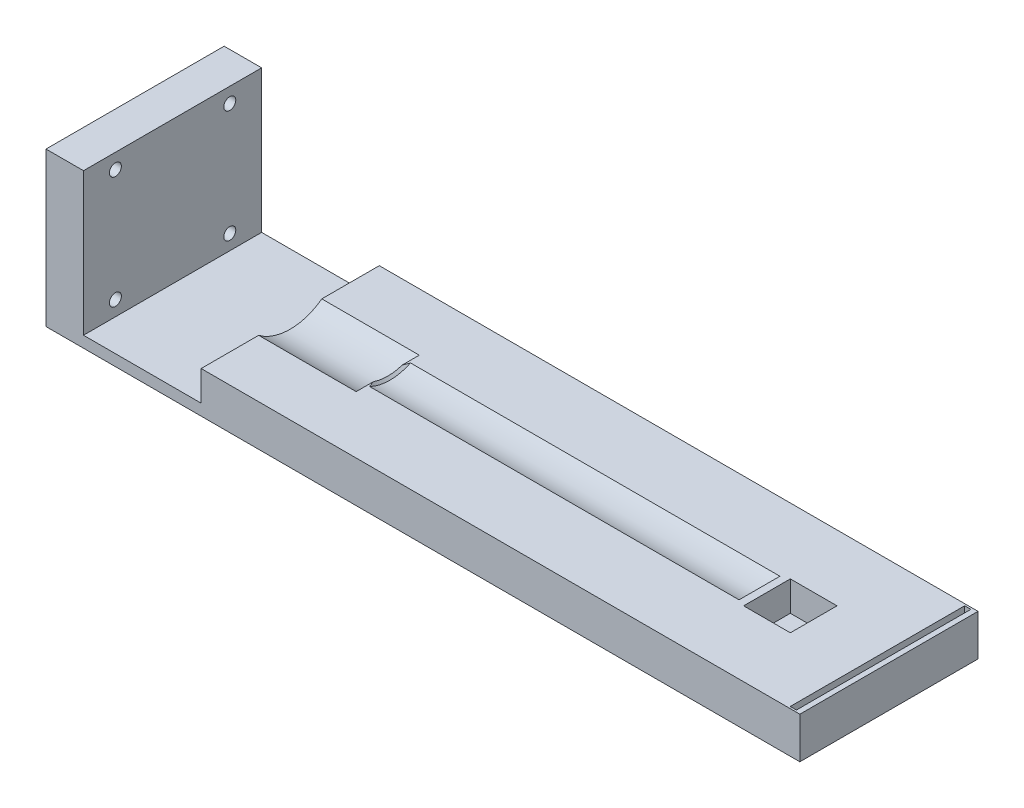
from build123d import *

# Parameters (mm, degrees)
SKETCH1_W               = 226
SKETCH1_H               = 84
BOSS_EXTRUDE1_DEPTH     = 20
SKETCH9_W               = 215
SKETCH9_H               = 38.50000016
BOSS_EXTRUDE2_DEPTH     = 10
SKETCH12_W              = 10
SKETCH12_H              = 38.50000016
BOSS_EXTRUDE4_DEPTH     = 38
SKETCH14_R              = 1.6
CUT_EXTRUDE2_DEPTH      = 38
SKETCH18_W              = 173.6342166
SKETCH18_H              = 38.50000016
BOSS_EXTRUDE5_DEPTH     = 8
SKETCH20_W              = 226
SKETCH20_H              = 20
BOSS_EXTRUDE6_DEPTH     = 27.35
SKETCH20_4_W            = 226
SKETCH20_4_H            = 20
CUT_EXTRUDE3_DEPTH      = 27.35
SKETCH22_W              = 226
SKETCH22_H              = 20
CUT_EXTRUDE4_DEPTH      = 18.14670137
SKETCH23_W              = 38.50329863
SKETCH23_H              = 20
CUT_EXTRUDE5_DEPTH      = 11
SKETCH24_W              = 215
SKETCH24_H              = 38.50329863
CUT_EXTRUDE6_DEPTH      = 27
SKETCH27_W              = 31.3657834
SKETCH27_H              = 3
BOSS_EXTRUDE8_DEPTH     = 4.5
SKETCH28_W              = 31.3657834
SKETCH28_H              = 3
BOSS_EXTRUDE9_DEPTH     = 4.5
CUT_EXTRUDE9_DEPTH      = 5
CUT_EXTRUDE9_DEPTH_BACK = 14
SKETCH30_W              = 47.50000016
SKETCH30_H              = 11
CAVITY2_START           = 555.357736953
CAVITY2_DEPTH           = 12.45
CAVITY2_2_OUTLINE_W     = 9.75
CAVITY2_2_OUTLINE_H     = 10.05
CAVITY2_2_DEPTH         = 1.2
CAVITY2_START_2         = 566.607736953
CAVITY2_3_OUTLINE_W     = 9.75
CAVITY2_3_OUTLINE_H     = 10.05
CAVITY2_3_DEPTH         = 1.2
SKETCH32_W              = 10.05
SKETCH32_H              = 10.05
CUT_EXTRUDE14_DEPTH     = 10
SKETCH34_W              = 12.45
SKETCH34_H              = 12.45
BOSS_EXTRUDE11_DEPTH    = 3
SKETCH35_W              = 1.65
SKETCH35_H              = 46.5
CUT_EXTRUDE15_DEPTH     = 7


# Read off the part's stored shape, not the designer's step: Cavity2
with BuildPart() as part:
    # Sketch1 → Boss-Extrude1 (new body)
    with BuildSketch(Plane(origin=(375.872687737, 0, 1298.443562055), x_dir=(1, 0, 0), z_dir=(0, 1, 0))):
        with Locations((113, -81.370523073)):
            Rectangle(SKETCH1_W, SKETCH1_H)
    extrude(amount=BOSS_EXTRUDE1_DEPTH)

    # Sketch9 → Boss-Extrude2 (add)
    with BuildSketch(Plane(origin=(0, 20, 0), x_dir=(1, 0, 0), z_dir=(0, 1, 0))):
        with Locations((494.372687737, -1375.210786579)):
            Rectangle(SKETCH9_W, SKETCH9_H)
    extrude(amount=BOSS_EXTRUDE2_DEPTH)

    # Sketch12 → Boss-Extrude4 (add)
    with BuildSketch(Plane(origin=(0, 30, 0), x_dir=(1, 0, 0), z_dir=(0, 1, 0))):
        with Locations((391.872687737, -1375.210786579)):
            Rectangle(SKETCH12_W, SKETCH12_H)
    extrude(amount=BOSS_EXTRUDE4_DEPTH)

    # Sketch14 → Cut-Extrude2 (cut)
    with BuildSketch(Plane(origin=(396.872687737, 0, 0), x_dir=(0, 0, -1), z_dir=(1, 0, 0))):
        with Locations((-1390.460786659, 64)):
            Circle(SKETCH14_R)
        with Locations((-1359.960786499, 64)):
            Circle(SKETCH14_R)
        with Locations((-1390.460786659, 34)):
            Circle(SKETCH14_R)
        with Locations((-1359.960786499, 34)):
            Circle(SKETCH14_R)
    extrude(amount=-CUT_EXTRUDE2_DEPTH, mode=Mode.SUBTRACT)

    # Sketch18 → Boss-Extrude5 (add)
    with BuildSketch(Plane(origin=(0, 30, 0), x_dir=(1, 0, 0), z_dir=(0, 1, 0))):
        with Locations((515.055579437, -1375.210786579)):
            Rectangle(SKETCH18_W, SKETCH18_H)
    extrude(amount=BOSS_EXTRUDE5_DEPTH)

    # Sketch20 → Boss-Extrude6 (add)
    with BuildSketch(Plane.XY.offset(1421.814085128)):
        with Locations((488.872687737, 10)):
            Rectangle(SKETCH20_W, SKETCH20_H)
    extrude(amount=-BOSS_EXTRUDE6_DEPTH)

    # Sketch20<4> → Cut-Extrude3 (cut)
    with BuildSketch(Plane.XY.offset(1421.814085128)):
        with Locations((488.872687737, 10)):
            Rectangle(SKETCH20_4_W, SKETCH20_4_H)
    extrude(amount=-CUT_EXTRUDE3_DEPTH, mode=Mode.SUBTRACT)

    # Sketch22 → Cut-Extrude4 (cut)
    with BuildSketch(Plane(origin=(0, 0, 1337.814085128), x_dir=(-1, 0, 0), z_dir=(0, 0, -1))):
        with Locations((-488.872687737, 10)):
            Rectangle(SKETCH22_W, SKETCH22_H)
    extrude(amount=-CUT_EXTRUDE4_DEPTH, mode=Mode.SUBTRACT)

    # Sketch23 → Cut-Extrude5 (cut)
    with BuildSketch(Plane.ZY.offset(-375.872687737)):
        with Locations((1375.212435813, 10)):
            Rectangle(SKETCH23_W, SKETCH23_H)
    extrude(amount=-CUT_EXTRUDE5_DEPTH, mode=Mode.SUBTRACT)

    # Sketch24 → Cut-Extrude6 (cut)
    with BuildSketch(Plane.XZ):
        with Locations((494.372687737, 1375.212435813)):
            Rectangle(SKETCH24_W, SKETCH24_H)
    extrude(amount=-CUT_EXTRUDE6_DEPTH, mode=Mode.SUBTRACT)

    # Sketch27 → Boss-Extrude8 (add)
    with BuildSketch(Plane.XY.offset(1394.460786659)):
        Polygon((396.872687737, 68), (386.872687737, 68), (386.872687737, 27), (396.872687737, 27), (396.872687737, 30), align=None)
        with Locations((412.555579437, 28.5)):
            Rectangle(SKETCH27_W, SKETCH27_H)
        Polygon((428.238471137, 38), (428.238471137, 30), (428.238471137, 27), (601.872687737, 27), (601.872687737, 38), align=None)
    extrude(amount=BOSS_EXTRUDE8_DEPTH)

    # Sketch28 → Boss-Extrude9 (add)
    with BuildSketch(Plane(origin=(0, 0, 1355.960786499), x_dir=(-1, 0, 0), z_dir=(0, 0, -1))):
        Polygon((-428.238471137, 38), (-601.872687737, 38), (-601.872687737, 27), (-428.238471137, 27), (-428.238471137, 30), align=None)
        with Locations((-412.555579437, 28.5)):
            Rectangle(SKETCH28_W, SKETCH28_H)
        Polygon((-396.872687737, 68), (-396.872687737, 30), (-396.872687737, 27), (-386.872687737, 27), (-386.872687737, 68), align=None)
    extrude(amount=BOSS_EXTRUDE9_DEPTH)

    # Sketch30 → Cut-Extrude9 (cut, two sides: drawn at the far end of the back side and taken through both)
    with BuildSketch(Plane(origin=(601.872687737, 0, 0), x_dir=(0, 0, -1), z_dir=(1, 0, 0)).offset(-CUT_EXTRUDE9_DEPTH_BACK)):
        with Locations((-1375.210786579, 32.5)):
            Rectangle(SKETCH30_W, SKETCH30_H)
    extrude(amount=CUT_EXTRUDE9_DEPTH + CUT_EXTRUDE9_DEPTH_BACK, mode=Mode.SUBTRACT)

    # Cavity2 outline → Cavity2 (cut)
    with BuildSketch(Plane.YZ.offset(CAVITY2_START)):
        Polygon((27.05, 1368.985786659), (38, 1368.985786659), (38, 1370.185786659), (28.25, 1370.185786659), (28.25, 1380.235786659), (38, 1380.235786659), (38, 1381.435786659), (27.05, 1381.435786659), align=None)
    extrude(amount=CAVITY2_DEPTH, mode=Mode.SUBTRACT)

    # Cavity2 2 outline → Cavity2 2 (cut)
    with BuildSketch(Plane.YZ.offset(CAVITY2_START)):
        with Locations((33.125, 1375.210786659)):
            Rectangle(CAVITY2_2_OUTLINE_W, CAVITY2_2_OUTLINE_H)
    extrude(amount=CAVITY2_2_DEPTH, mode=Mode.SUBTRACT)

    # Cavity2 3 outline → Cavity2 3 (cut)
    with BuildSketch(Plane.YZ.offset(CAVITY2_START_2)):
        with Locations((33.125, 1375.210786659)):
            Rectangle(CAVITY2_3_OUTLINE_W, CAVITY2_3_OUTLINE_H)
    extrude(amount=CAVITY2_3_DEPTH, mode=Mode.SUBTRACT)

    # Cavity2 4 outline → Cavity2 4 (revolve, cut)
    with BuildSketch(Plane(origin=(0, 49.25, 1375.210786659), x_dir=(0, 1, 0), z_dir=(0, 0, -1))):
        Polygon((14.05, 428.238471137), (14.05, 454.238471137), (11.893245894, 454.238471137), (12.500000005, 454.857736959), (12.5, 553.357736953), (11.25, 553.357736953), (11.25, 428.238471137), align=None)
    revolve(axis=Axis((0, 49.25, 1375.210786659), (1, 0, 0)), mode=Mode.SUBTRACT)

    # Sketch32 → Cut-Extrude14 (cut)
    with BuildSketch(Plane(origin=(0, 38, 0), x_dir=(1, 0, 0), z_dir=(0, 1, 0))):
        with Locations((561.582736953, -1375.210786659)):
            Rectangle(SKETCH32_W, SKETCH32_H)
    extrude(amount=-CUT_EXTRUDE14_DEPTH, mode=Mode.SUBTRACT)

    # Sketch34 → Boss-Extrude11 (add)
    with BuildSketch(Plane(origin=(0, 27.05, 0), x_dir=(1, 0, 0), z_dir=(0, 1, 0))):
        with Locations((561.582736953, -1375.210786659)):
            Rectangle(SKETCH34_W, SKETCH34_H)
    extrude(amount=BOSS_EXTRUDE11_DEPTH)

    # Sketch35 → Cut-Extrude15 (cut)
    with BuildSketch(Plane(origin=(0, 38, 0), x_dir=(1, 0, 0), z_dir=(0, 1, 0))):
        with Locations((585.632736953, -1375.210786659)):
            Rectangle(SKETCH35_W, SKETCH35_H)
    extrude(amount=-CUT_EXTRUDE15_DEPTH, mode=Mode.SUBTRACT)


solid = part.part
